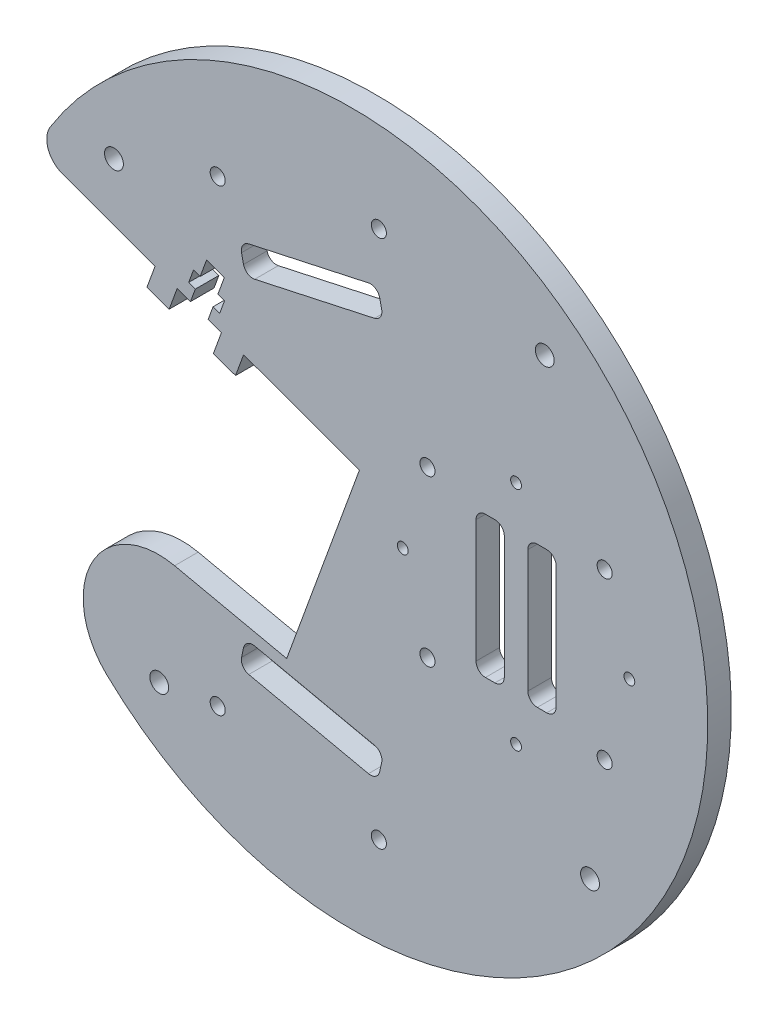
from build123d import *

# Parameters (mm, degrees)
ESQUISSE1_R        = 2
ESQUISSE1_R_2      = 1.6
ESQUISSE1_R_3      = 1.15
BOSS_EXTRU_1_DEPTH = 5
CONG_1_R           = 16
CONG_2_R           = 5


with BuildPart() as part:
    # Esquisse1 → Boss.-Extru.1 (new body)
    with BuildSketch(Plane.XY):
        with BuildLine():
            Line((-67.043743505, 34.718675909), (-41.789550091, 25.514872575))
            Line((-41.789550091, 25.514872575), (-43.501626461, 20.81712902))
            Line((-43.501626461, 20.81712902), (-38.803882906, 19.10505265))
            Line((-38.803882906, 19.10505265), (-37.091806536, 23.802796205))
            Line((-37.091806536, 23.802796205), (-34.273160404, 22.775550383))
            Line((-34.273160404, 22.775550383), (-33.245914582, 25.594196515))
            Line((-33.245914582, 25.594196515), (-34.655237648, 26.107819426))
            Line((-34.655237648, 26.107819426), (-33.627991826, 28.926465559))
            Line((-33.627991826, 28.926465559), (-32.21866876, 28.412842648))
            Line((-32.21866876, 28.412842648), (-30.849007664, 32.171037492))
            Line((-30.849007664, 32.171037492), (-27.09081282, 30.801376396))
            Line((-27.09081282, 30.801376396), (-28.460473916, 27.043181552))
            Line((-28.460473916, 27.043181552), (-27.05115085, 26.529558641))
            Line((-27.05115085, 26.529558641), (-28.078396672, 23.710912508))
            Line((-28.078396672, 23.710912508), (-29.487719738, 24.224535419))
            Line((-29.487719738, 24.224535419), (-30.51496556, 21.405889287))
            Line((-30.51496556, 21.405889287), (-27.696319427, 20.378643465))
            Line((-27.696319427, 20.378643465), (-29.408395797, 15.68089991))
            Line((-29.408395797, 15.68089991), (-24.710652243, 13.96882354))
            Line((-24.710652243, 13.96882354), (-22.998575873, 18.666567095))
            Line((-22.998575873, 18.666567095), (1.569593433, 9.712782871))
            Line((1.569593433, 9.712782871), (-13.85803971, -32.618894281))
            Line((-13.85803971, -32.618894281), (-72.8619706, -19.783408206))
            ThreePointArc((-72.8619706, -19.783408206), (75.07344073, -8.014268337), (-67.043743505, 34.718675909))
        make_face()
        with Locations((-40.905825418, -50.514487495)):
            Circle(ESQUISSE1_R, mode=Mode.SUBTRACT)
        with Locations((-28.497621404, -48.673941395)):
            Circle(ESQUISSE1_R_2, mode=Mode.SUBTRACT)
        with BuildLine():
            ThreePointArc((4.770167119, -39.229670816), (6.027544078, -40.102682233), (6.299331559, -41.6090943))
            Line((6.299331559, -41.6090943), (5.874202037, -43.563388261))
            ThreePointArc((5.874202037, -43.563388261), (5.00119062, -44.82076522), (3.494778553, -45.092552701))
            Line((3.494778553, -45.092552701), (-21.911042951, -39.565868916))
            ThreePointArc((-21.911042951, -39.565868916), (-23.16841991, -38.692857499), (-23.440207391, -37.186445432))
            Line((-23.440207391, -37.186445432), (-23.015077869, -35.23215147))
            ThreePointArc((-23.015077869, -35.23215147), (-22.142066452, -33.974774511), (-20.635654385, -33.70298703))
            Line((-20.635654385, -33.70298703), (4.770167119, -39.229670816))
        make_face(mode=Mode.SUBTRACT)
        with Locations((5.702522929, -56.11370803)):
            Circle(ESQUISSE1_R_2, mode=Mode.SUBTRACT)
        with Locations((50.514487495, -40.905825418)):
            Circle(ESQUISSE1_R, mode=Mode.SUBTRACT)
        with Locations((34.819184968, -24.04163056)):
            Circle(ESQUISSE1_R_3, mode=Mode.SUBTRACT)
        with Locations((16.019184968, -17.5)):
            Circle(ESQUISSE1_R_2, mode=Mode.SUBTRACT)
        with Locations((53.619184968, -17.5)):
            Circle(ESQUISSE1_R_2, mode=Mode.SUBTRACT)
        with Locations((-50.514487495, 40.905825418)):
            Circle(ESQUISSE1_R, mode=Mode.SUBTRACT)
        with Locations((-28.497621404, 48.673941395)):
            Circle(ESQUISSE1_R_2, mode=Mode.SUBTRACT)
        with BuildLine():
            ThreePointArc((-20.635654385, 33.70298703), (-22.142066452, 33.974774511), (-23.015077869, 35.23215147))
            Line((-23.015077869, 35.23215147), (-23.440207391, 37.186445432))
            ThreePointArc((-23.440207391, 37.186445432), (-23.16841991, 38.692857499), (-21.911042951, 39.565868916))
            Line((-21.911042951, 39.565868916), (3.494778553, 45.092552701))
            ThreePointArc((3.494778553, 45.092552701), (5.00119062, 44.82076522), (5.874202037, 43.563388261))
            Line((5.874202037, 43.563388261), (6.299331559, 41.6090943))
            ThreePointArc((6.299331559, 41.6090943), (6.027544078, 40.102682233), (4.770167119, 39.229670816))
            Line((4.770167119, 39.229670816), (-20.635654385, 33.70298703))
        make_face(mode=Mode.SUBTRACT)
        with Locations((10.777554407, 0)):
            Circle(ESQUISSE1_R_3, mode=Mode.SUBTRACT)
        with Locations((16.019184968, 17.5)):
            Circle(ESQUISSE1_R_2, mode=Mode.SUBTRACT)
        with BuildLine():
            ThreePointArc((32.319184968, -13), (31.73339853, -14.414213562), (30.319184968, -15))
            Line((30.319184968, -15), (28.319184968, -15))
            ThreePointArc((28.319184968, -15), (26.904971405, -14.414213562), (26.319184968, -13))
            Line((26.319184968, -13), (26.319184968, 13))
            ThreePointArc((26.319184968, 13), (26.904971405, 14.414213562), (28.319184968, 15))
            Line((28.319184968, 15), (30.319184968, 15))
            ThreePointArc((30.319184968, 15), (31.73339853, 14.414213562), (32.319184968, 13))
            Line((32.319184968, 13), (32.319184968, -13))
        make_face(mode=Mode.SUBTRACT)
        with Locations((34.819184968, 24.04163056)):
            Circle(ESQUISSE1_R_3, mode=Mode.SUBTRACT)
        with BuildLine():
            ThreePointArc((37.319184968, 13), (37.904971405, 14.414213562), (39.319184968, 15))
            Line((39.319184968, 15), (41.319184968, 15))
            ThreePointArc((41.319184968, 15), (42.73339853, 14.414213562), (43.319184968, 13))
            Line((43.319184968, 13), (43.319184968, -13))
            ThreePointArc((43.319184968, -13), (42.73339853, -14.414213562), (41.319184968, -15))
            Line((41.319184968, -15), (39.319184968, -15))
            ThreePointArc((39.319184968, -15), (37.904971405, -14.414213562), (37.319184968, -13))
            Line((37.319184968, -13), (37.319184968, 13))
        make_face(mode=Mode.SUBTRACT)
        with Locations((53.619184968, 17.5)):
            Circle(ESQUISSE1_R_2, mode=Mode.SUBTRACT)
        with Locations((58.860815528, 0)):
            Circle(ESQUISSE1_R_3, mode=Mode.SUBTRACT)
        with Locations((5.702522929, 56.11370803)):
            Circle(ESQUISSE1_R_2, mode=Mode.SUBTRACT)
        with Locations((40.905825418, 50.514487495)):
            Circle(ESQUISSE1_R, mode=Mode.SUBTRACT)
    extrude(amount=BOSS_EXTRU_1_DEPTH)

    # Congé1
    cong_1_edges = [part.edges().sort_by_distance(p)[0] for p in [
        (-72.8619706, -19.783408206, 2.5),
    ]]
    fillet(cong_1_edges, radius=CONG_1_R)

    # Congé2
    cong_2_edges = [part.edges().sort_by_distance(p)[0] for p in [
        (-67.043743505, 34.718675909, 2.5),
    ]]
    fillet(cong_2_edges, radius=CONG_2_R)


solid = part.part
